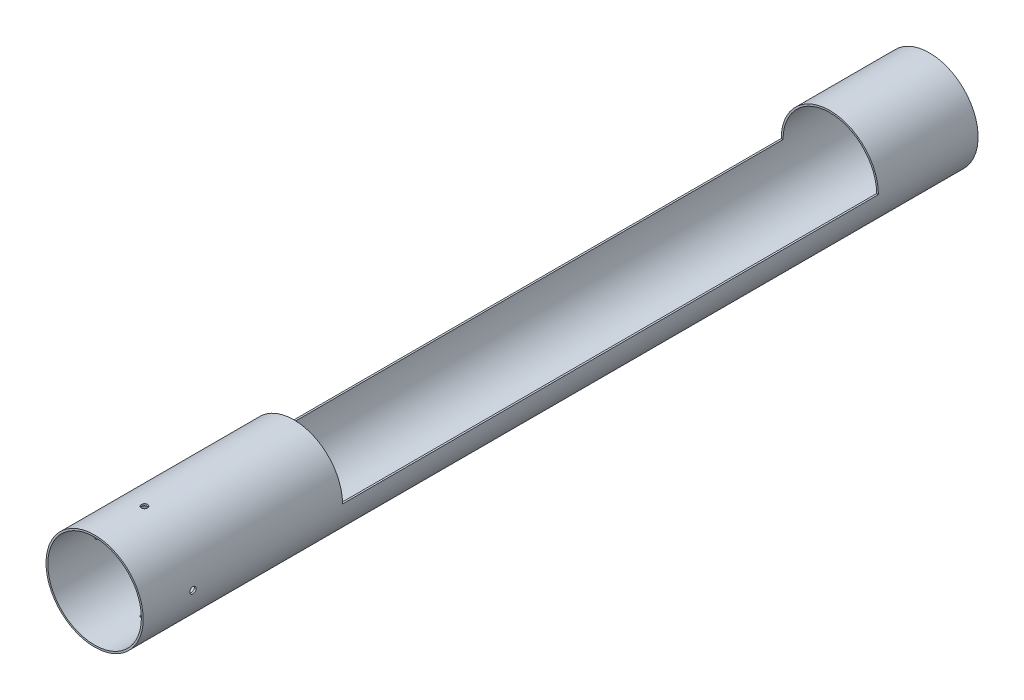
from build123d import *

# Parameters (mm, degrees)
BOSS_EXTRUDE1_DEPTH = 546.1
SKETCH2_R           = 49.5046
SKETCH2_R_2         = 47.6885
BOSS_EXTRUDE2_DEPTH = 203.2
BOSS_EXTRUDE3_START = 101.6
SKETCH3_R           = 49.5046
SKETCH3_R_2         = 47.6885
BOSS_EXTRUDE3_DEPTH = 101.6
SKETCH4_R           = 3.175
CUT_EXTRUDE1_DEPTH  = 753.563552693
CIRPATTERN1_COUNT   = 4


with BuildPart() as part:
    # Sketch1 → Boss-Extrude1 (new body)
    with BuildSketch(Plane.XY):
        with BuildLine():
            Line((-49.5046, 0), (-47.6885, 0))
            ThreePointArc((-47.6885, 0), (0, -47.6885), (47.6885, 0))
            Line((47.6885, 0), (49.5046, 0))
            ThreePointArc((49.5046, 0), (0, -49.5046), (-49.5046, 0))
        make_face()
    extrude(amount=BOSS_EXTRUDE1_DEPTH)

    # Sketch2 → Boss-Extrude2 (add)
    with BuildSketch(Plane.XY.offset(546.1)):
        Circle(SKETCH2_R)
        Circle(SKETCH2_R_2, mode=Mode.SUBTRACT)
    extrude(amount=BOSS_EXTRUDE2_DEPTH)

    # Sketch3 → Boss-Extrude3 (add)
    with BuildSketch(Plane(origin=(0, 0, 0), x_dir=(-1, 0, 0), z_dir=(0, 0, -1)).offset(BOSS_EXTRUDE3_START)):
        Circle(SKETCH3_R)
        Circle(SKETCH3_R_2, mode=Mode.SUBTRACT)
    extrude(amount=-BOSS_EXTRUDE3_DEPTH)

    # Sketch4 → Cut-Extrude1 (cut, through all)
    with BuildSketch(Plane(origin=(0, 0, 0), x_dir=(1, 0, 0), z_dir=(0, 1, 0))):
        with Locations((0, -698.5)):
            Circle(SKETCH4_R)
    cut_extrude1 = extrude(amount=-CUT_EXTRUDE1_DEPTH, mode=Mode.SUBTRACT)

    # CirPattern1: Cut-Extrude1 ×4 about axis
    cirpattern1_axis = Axis((0, 0, 546.1), (0, 0, -1))
    for i in range(1, CIRPATTERN1_COUNT):
        add(cut_extrude1.rotate(cirpattern1_axis, i * 360 / CIRPATTERN1_COUNT), mode=Mode.SUBTRACT)


solid = part.part
